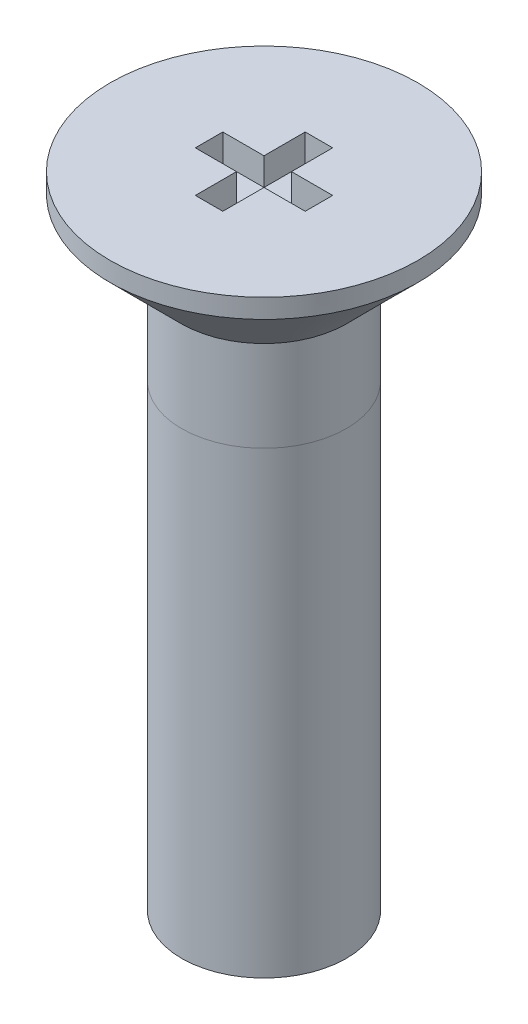
from build123d import *

# Parameters (mm, degrees)
SKETCH1_R           = 1.5
BOSS_EXTRUDE1_DEPTH = 8.35
SKETCH2_R           = 1.5
BOSS_EXTRUDE2_DEPTH = 1.65
SKETCH3_R           = 2.8
BOSS_EXTRUDE3_DEPTH = 1.65
CUT_EXTRUDE2_DEPTH  = 0.5


with BuildPart() as part:
    # Sketch1 → Boss-Extrude1 (new body)
    with BuildSketch(Plane(origin=(0, 0, 0), x_dir=(1, 0, 0), z_dir=(0, 1, 0))):
        Circle(SKETCH1_R)
    extrude(amount=BOSS_EXTRUDE1_DEPTH)


with BuildPart() as body_2:
    # Sketch2 → Boss-Extrude2 (new body)
    with BuildSketch(Plane(origin=(0, 8.35, 0), x_dir=(1, 0, 0), z_dir=(0, 1, 0))):
        Circle(SKETCH2_R)
    extrude(amount=BOSS_EXTRUDE2_DEPTH)


with BuildPart() as body_3:
    # Sketch3 → Boss-Extrude3 (new body)
    with BuildSketch(Plane(origin=(0, 10, 0), x_dir=(1, 0, 0), z_dir=(0, 1, 0))):
        Circle(SKETCH3_R)
    extrude(amount=BOSS_EXTRUDE3_DEPTH)

    # Sketch6 → Cut-Revolve1 (revolve, cut)
    with BuildSketch(Plane.XY):
        Polygon((2.8, 11.3), (1.5, 10), (2.8, 10), align=None)
    revolve(axis=Axis((0, 0, 0), (0, 1, 0)), mode=Mode.SUBTRACT)

    # Sketch7 → Cut-Extrude2 (cut)
    with BuildSketch(Plane(origin=(0, 11.65, 0), x_dir=(1, 0, 0), z_dir=(0, 1, 0))):
        Polygon((0.25, 1), (-0.25, 1), (-0.25, 0.25), (-1, 0.25), (-1, -0.25), (-0.25, -0.25), (-0.25, -1), (0.25, -1), (0.25, -0.25), (1, -0.25), (1, 0.25), (0.25, 0.25), align=None)
    extrude(amount=-CUT_EXTRUDE2_DEPTH, mode=Mode.SUBTRACT)


solid = Compound([part.part, body_2.part, body_3.part])
